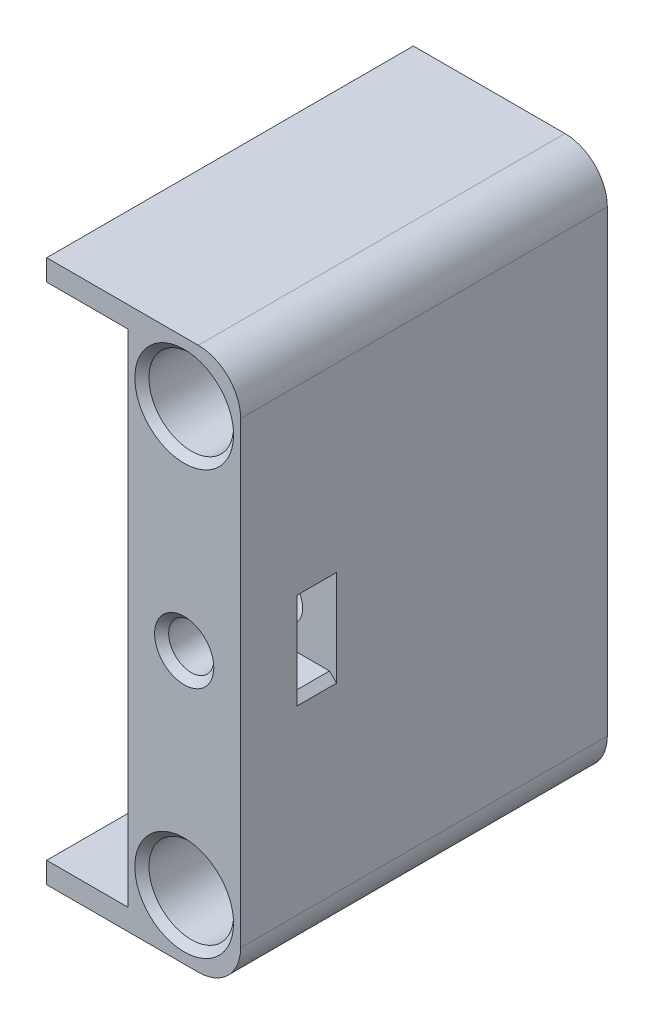
from build123d import *

# Parameters (mm, degrees)
SKETCH1_R           = 1.6
BOSS_EXTRUDE1_DEPTH = 26
SKETCH2_R           = 3
CUT_EXTRUDE1_DEPTH  = 19
CUT_EXTRUDE2_START  = -4
SKETCH3_W           = 8
SKETCH3_H           = 5.8
CUT_EXTRUDE2_DEPTH  = 2.8
FILLET1_R           = 3
CHAMFER1_SIZE       = 0.5


with BuildPart() as part:
    # Sketch1 → Boss-Extrude1 (new body)
    with BuildSketch(Plane.XY):
        Polygon((-5.75, -17.75), (-5.75, -19.25), (8, -19.25), (8, 19.25), (-5.75, 19.25), (-5.75, 17.75), (0, 17.75), (0, -17.75), align=None)
        with Locations((4, 15)):
            Circle(SKETCH1_R, mode=Mode.SUBTRACT)
        with Locations((4, 0)):
            Circle(SKETCH1_R, mode=Mode.SUBTRACT)
        with Locations((4, -15)):
            Circle(SKETCH1_R, mode=Mode.SUBTRACT)
    extrude(amount=BOSS_EXTRUDE1_DEPTH)

    # Sketch2 → Cut-Extrude1 (cut)
    with BuildSketch(Plane.XY.offset(26)):
        with Locations((4, 15)):
            Circle(SKETCH2_R)
        with Locations((4, -15)):
            Circle(SKETCH2_R)
    extrude(amount=-CUT_EXTRUDE1_DEPTH, mode=Mode.SUBTRACT)

    # Sketch3 → Cut-Extrude2 (cut)
    with BuildSketch(Plane.XY.offset(26).offset(CUT_EXTRUDE2_START)):
        with Locations((4, 0)):
            Rectangle(SKETCH3_W, SKETCH3_H)
    extrude(amount=-CUT_EXTRUDE2_DEPTH, mode=Mode.SUBTRACT)

    # Fillet1
    fillet1_edges = [part.edges().sort_by_distance(p)[0] for p in [
        (8, -19.25, 13),
        (8, 19.25, 13),
    ]]
    fillet(fillet1_edges, radius=FILLET1_R)

    # Chamfer1
    chamfer1_edges = [part.edges().sort_by_distance(p)[0] for p in [
        (2.4, 15, 0),
        (2.4, 0, 0),
        (2.4, -15, 0),
        (1, -15, 26),
        (1, 15, 26),
        (2.4, 0, 26),
        (8, 2.9, 20.6),
        (8, -2.9, 20.6),
    ]]
    chamfer(chamfer1_edges, length=CHAMFER1_SIZE)


solid = part.part
